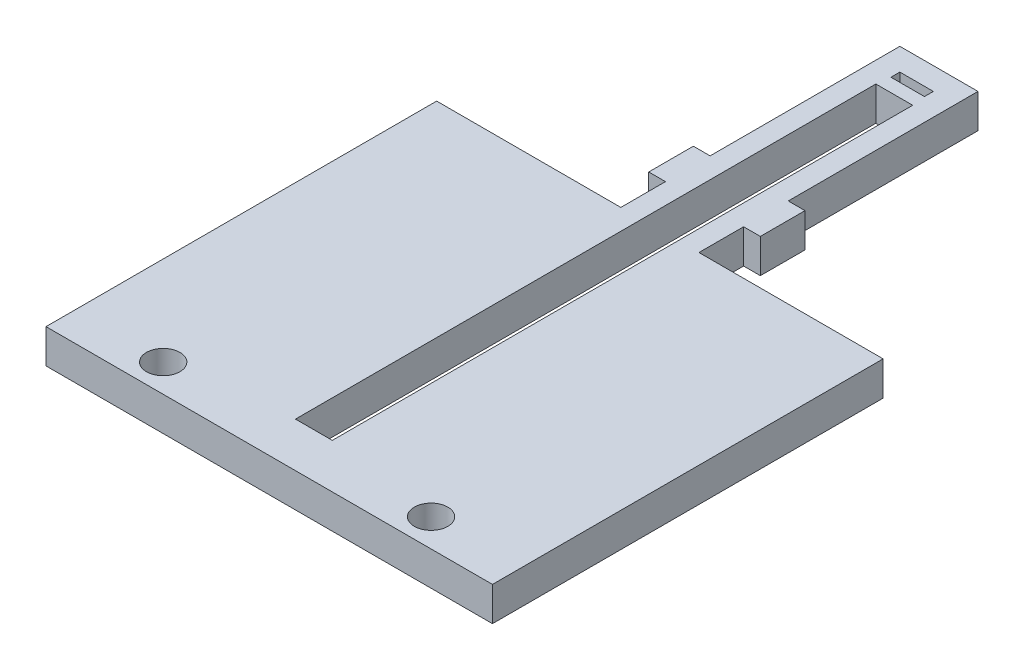
from build123d import *

# Parameters (mm, degrees)
SKETCH1_W           = 40
SKETCH1_H           = 60
BOSS_EXTRUDE1_DEPTH = 3.05
SKETCH4_W           = 3
SKETCH4_H           = 0.8
SKETCH4_W_2         = 3.3
SKETCH4_H_2         = 52
CUT_EXTRUDE1_DEPTH  = 10
CUT_EXTRUDE3_DEPTH  = 10
SKETCH7_R           = 1.5
CUT_EXTRUDE4_DEPTH  = 10


with BuildPart() as part:
    # Sketch1 → Boss-Extrude1 (new body)
    with BuildSketch(Plane(origin=(0, 0, 0), x_dir=(1, 0, 0), z_dir=(0, 1, 0))):
        with Locations((20, 30)):
            Rectangle(SKETCH1_W, SKETCH1_H)
    extrude(amount=BOSS_EXTRUDE1_DEPTH)

    # Sketch4 → Cut-Extrude1 (cut)
    with BuildSketch(Plane(origin=(0, 3.05, 0), x_dir=(1, 0, 0), z_dir=(0, 1, 0))):
        with Locations((20, 57.6)):
            Rectangle(SKETCH4_W, SKETCH4_H)
        with Locations((20, 30)):
            Rectangle(SKETCH4_W_2, SKETCH4_H_2)
    extrude(amount=-CUT_EXTRUDE1_DEPTH, mode=Mode.SUBTRACT)

    # Sketch6 → Cut-Extrude3 (cut)
    with BuildSketch(Plane(origin=(0, 3.05, 0), x_dir=(1, 0, 0), z_dir=(0, 1, 0))):
        Polygon((0, 60), (0, 35), (16.5, 35), (16.5, 39), (15, 39), (15, 43), (16.5, 43), (16.5, 60), align=None)
        Polygon((40, 60), (40, 35), (23.5, 35), (23.5, 39), (25, 39), (25, 43), (23.5, 43), (23.5, 60), align=None)
    extrude(amount=-CUT_EXTRUDE3_DEPTH, mode=Mode.SUBTRACT)

    # Sketch7 → Cut-Extrude4 (cut)
    with BuildSketch(Plane(origin=(0, 3.05, 0), x_dir=(1, 0, 0), z_dir=(0, 1, 0))):
        with Locations((8, 2.5)):
            Circle(SKETCH7_R)
        with Locations((32, 2.5)):
            Circle(SKETCH7_R)
    extrude(amount=-CUT_EXTRUDE4_DEPTH, mode=Mode.SUBTRACT)


solid = part.part
